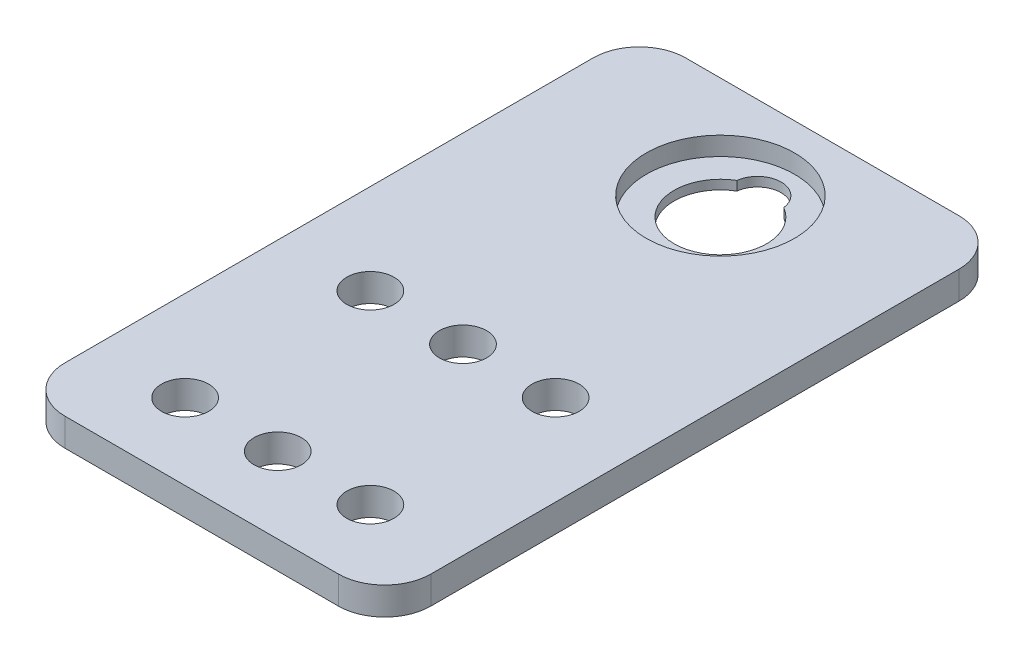
from build123d import *

# Parameters (mm, degrees)
SKETCH1_R           = 2.55
BOSS_EXTRUDE1_DEPTH = 3
SKETCH5_R           = 8.002
CUT_EXTRUDE8_DEPTH  = 2
SKETCH6_R           = 5
CUT_EXTRUDE9_DEPTH  = 10


with BuildPart() as part:
    # Sketch1 → Boss-Extrude1 (new body)
    with BuildSketch(Plane(origin=(0, 0, 0), x_dir=(1, 0, 0), z_dir=(0, 1, 0))):
        with BuildLine():
            Line((14.75, -33.5), (-14.75, -33.5))
            ThreePointArc((-14.75, -33.5), (-18.285533906, -32.035533906), (-19.75, -28.5))
            Line((-19.75, -28.5), (-19.75, 28.5))
            ThreePointArc((-19.75, 28.5), (-18.285533906, 32.035533906), (-14.75, 33.5))
            Line((-14.75, 33.5), (14.75, 33.5))
            ThreePointArc((14.75, 33.5), (18.285533906, 32.035533906), (19.75, 28.5))
            Line((19.75, 28.5), (19.75, -28.5))
            ThreePointArc((19.75, -28.5), (18.285533906, -32.035533906), (14.75, -33.5))
        make_face()
        with Locations((0, 26.5)):
            Circle(SKETCH1_R, mode=Mode.SUBTRACT)
        with Locations((10, -25.29)):
            Circle(SKETCH1_R, mode=Mode.SUBTRACT)
        with Locations((10, -5.29)):
            Circle(SKETCH1_R, mode=Mode.SUBTRACT)
        with Locations((0, -25.29)):
            Circle(SKETCH1_R, mode=Mode.SUBTRACT)
        with Locations((0, -5.29)):
            Circle(SKETCH1_R, mode=Mode.SUBTRACT)
        with Locations((-10, -25.29)):
            Circle(SKETCH1_R, mode=Mode.SUBTRACT)
        with Locations((-10, -5.29)):
            Circle(SKETCH1_R, mode=Mode.SUBTRACT)
    extrude(amount=BOSS_EXTRUDE1_DEPTH)

    # Sketch5 → Cut-Extrude8 (cut)
    with BuildSketch(Plane(origin=(0, 3, 0), x_dir=(1, 0, 0), z_dir=(0, 1, 0))):
        with Locations((0, 22.5)):
            Circle(SKETCH5_R)
    extrude(amount=-CUT_EXTRUDE8_DEPTH, mode=Mode.SUBTRACT)

    # Sketch6 → Cut-Extrude9 (cut)
    with BuildSketch(Plane(origin=(0, 3, 0), x_dir=(1, 0, 0), z_dir=(0, 1, 0))):
        with Locations((0, 22.5)):
            Circle(SKETCH6_R)
    extrude(amount=-CUT_EXTRUDE9_DEPTH, mode=Mode.SUBTRACT)


solid = part.part
